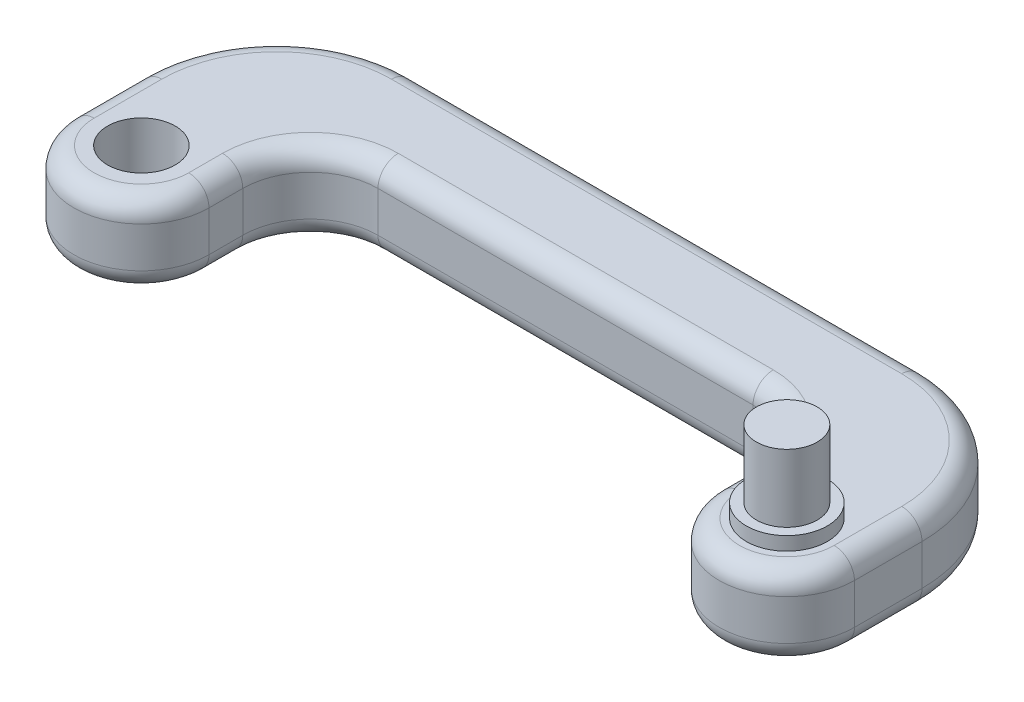
from build123d import *

# Parameters (mm, degrees)
SKETCH7_R           = 5
BOSS_EXTRUDE5_DEPTH = 12
SKETCH8_R           = 6
BOSS_EXTRUDE6_DEPTH = 2
SKETCH9_R           = 4.5
BOSS_EXTRUDE7_DEPTH = 10
FILLET2_R           = 20
FILLET3_R           = 10
FILLET5_R           = 3


with BuildPart() as part:
    # Sketch7 → Boss-Extrude5 (new body)
    with BuildSketch(Plane(origin=(0, 0, 0), x_dir=(1, 0, 0), z_dir=(0, 1, 0))):
        with BuildLine():
            Line((-105.5, 30), (-105.5, 0))
            ThreePointArc((-105.5, 0), (-95.5, -10), (-85.5, 0))
            Line((-85.5, 0), (-85.5, 15))
            Line((-85.5, 15), (-10, 15))
            Line((-10, 15), (-10, 0))
            ThreePointArc((-10, 0), (0, -10), (10, 0))
            Line((10, 0), (10, 30))
            Line((10, 30), (-10, 30))
            Line((-10, 30), (-85.5, 30))
            Line((-85.5, 30), (-105.5, 30))
        make_face()
        with Locations((-95.5, 0)):
            Circle(SKETCH7_R, mode=Mode.SUBTRACT)
    extrude(amount=BOSS_EXTRUDE5_DEPTH)

    # Sketch8 → Boss-Extrude6 (add)
    with BuildSketch(Plane(origin=(0, 12, 0), x_dir=(1, 0, 0), z_dir=(0, 1, 0))):
        Circle(SKETCH8_R)
    extrude(amount=BOSS_EXTRUDE6_DEPTH)

    # Sketch9 → Boss-Extrude7 (add)
    with BuildSketch(Plane(origin=(0, 14, 0), x_dir=(1, 0, 0), z_dir=(0, 1, 0))):
        Circle(SKETCH9_R)
    extrude(amount=BOSS_EXTRUDE7_DEPTH)

    # Fillet2
    fillet2_edges = [part.edges().sort_by_distance(p)[0] for p in [
        (10, 6, -30),
        (-105.5, 6, -30),
    ]]
    fillet(fillet2_edges, radius=FILLET2_R)

    # Fillet3
    fillet3_edges = [part.edges().sort_by_distance(p)[0] for p in [
        (-10, 6, -15),
        (-85.5, 6, -15),
    ]]
    fillet(fillet3_edges, radius=FILLET3_R)

    # Fillet5
    fillet5_edges = [part.edges().sort_by_distance(p)[0] for p in [
        (-47.75, 12, -30),
        (4.142135624, 12, -24.142135624),
        (10, 12, -5),
        (0, 12, 10),
        (-10, 12, -2.5),
        (-12.928932188, 12, -12.071067812),
        (-47.75, 12, -15),
        (-82.571067812, 12, -12.071067812),
        (-85.5, 12, -2.5),
        (-95.5, 12, 10),
        (-105.5, 12, -5),
        (-105.5, 0, -5),
        (-95.5, 0, 10),
        (-85.5, 0, -2.5),
        (-82.571067812, 0, -12.071067812),
        (-47.75, 0, -15),
        (-12.928932188, 0, -12.071067812),
        (-10, 0, -2.5),
        (0, 0, 10),
        (10, 0, -5),
        (4.142135624, 0, -24.142135624),
        (-47.75, 0, -30),
        (-99.642135624, 12, -24.142135624),
        (-99.642135624, 0, -24.142135624),
    ]]
    fillet(fillet5_edges, radius=FILLET5_R)


solid = part.part
